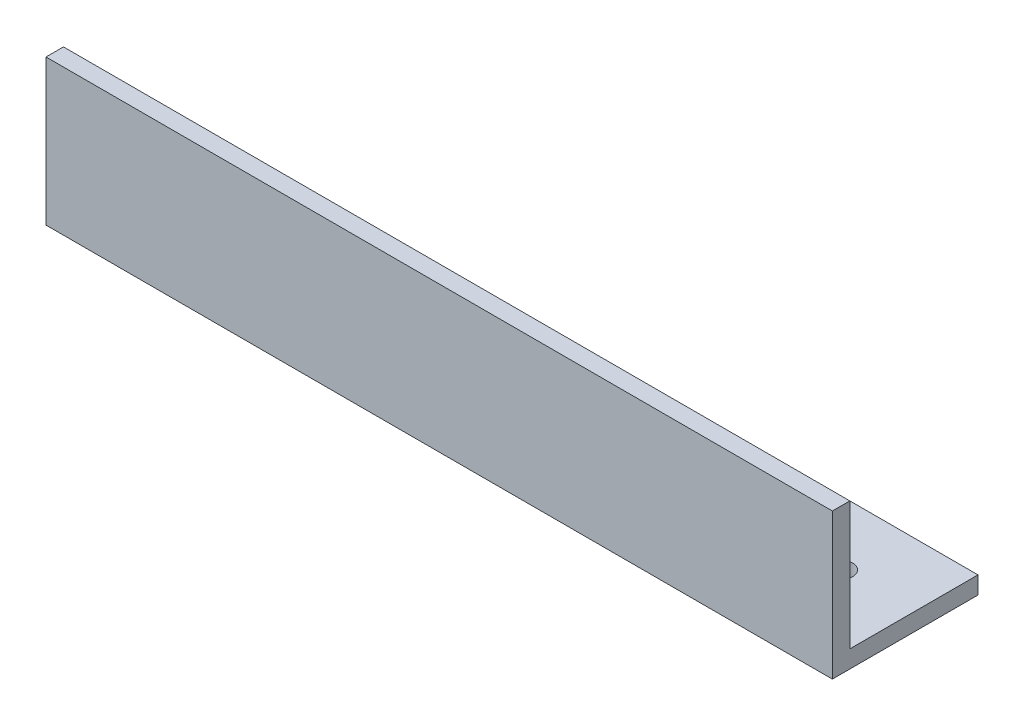
from build123d import *

# Parameters (mm, degrees)
EXTRUDE_2_DEPTH     = 270
SKETCH_2_R          = 4
CUT_EXTRUDE_1_DEPTH = 280.105714739


with BuildPart() as part:
    # Эскиз1 → Вытянуть-Тонкостенный2 (new body)
    with BuildSketch(Plane(origin=(0, 0, 0), x_dir=(0, 0, -1), z_dir=(1, 0, 0))):
        Polygon((0, 50), (0, 0), (50, 0), (50, 6), (6, 6), (6, 50), align=None)
    extrude(amount=EXTRUDE_2_DEPTH)

    # Эскиз2 → Вырез-Вытянуть1 (cut, through all)
    with BuildSketch(Plane.XZ):
        with Locations((25, -28)):
            Circle(SKETCH_2_R)
        with Locations((245, -28)):
            Circle(SKETCH_2_R)
    extrude(amount=-CUT_EXTRUDE_1_DEPTH, mode=Mode.SUBTRACT)


solid = part.part
